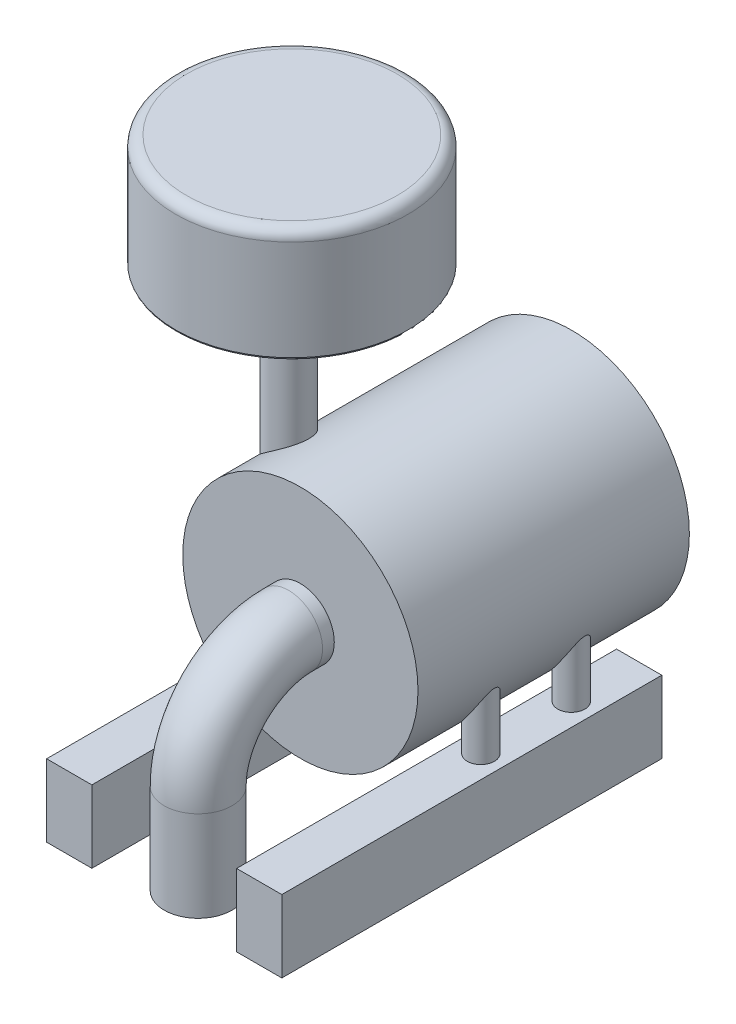
from build123d import *

# Parameters (mm, degrees)
SKETCH1_R                = 130
BOSS_EXTRUDE1_DEPTH      = 300
SKETCH2_R                = 37.5
BOSS_EXTRUDE2_DEPTH      = 13
SKETCH3_R                = 117
SKETCH3_R_2              = 72
CUT_EXTRUDE1_DEPTH       = 13
CUT_EXTRUDE1_DRAFT       = -30
SKETCH4_R                = 22.5
BOSS_EXTRUDE3_DEPTH      = 7
BOSS_EXTRUDE3_TAPER      = 30
BOSS_EXTRUDE4_REACH      = 665
BOSS_EXTRUDE4_END_RADIUS = 130
BOSS_EXTRUDE4_START      = 300
SKETCH5_R                = 22.5
SKETCH7_R                = 37.5
BOSS_EXTRUDE5_START      = -120
SKETCH9_W                = 50
SKETCH9_H                = 420
BOSS_EXTRUDE5_DEPTH      = 79.88
BOSS_EXTRUDE6_REACH      = 631.484
BOSS_EXTRUDE6_END_RADIUS = 130
SKETCH10_R               = 15
SHELL1_T                 = -2


with BuildPart() as part:
    # Sketch1 → Boss-Extrude1 (new body)
    with BuildSketch(Plane.XY):
        Circle(SKETCH1_R)
    extrude(amount=BOSS_EXTRUDE1_DEPTH)

    # Sketch2 → Boss-Extrude2 (add)
    with BuildSketch(Plane.XY.offset(300)):
        with Locations(Location((0, 0, 0), (0, 0, 180))):
            Circle(SKETCH2_R)
    extrude(amount=BOSS_EXTRUDE2_DEPTH)


with BuildPart() as cut_extrude1_tool:
    # Sketch3 → Cut-Extrude1 (with draft: the straight prism first)
    with BuildSketch(Plane(origin=(0, 0, 0), x_dir=(-1, 0, 0), z_dir=(0, 0, -1))):
        Circle(SKETCH3_R)
        Circle(SKETCH3_R_2, mode=Mode.SUBTRACT)
    extrude(amount=-CUT_EXTRUDE1_DEPTH)
    # Cut-Extrude1: the draft: its side faces are tilted about the plane it starts from
    cut_extrude1_sides = [cut_extrude1_tool.faces().sort_by_distance(p)[0] for p in [
        (117, 0, 6.5),
        (72, 0, 6.5),
    ]]
    draft(cut_extrude1_sides, Plane(origin=(0, 0, 0), x_dir=(-1, 0, 0), z_dir=(0, 0, -1)), CUT_EXTRUDE1_DRAFT)


with BuildPart() as part_1:
    add(part.part)

    # Cut-Extrude1: cut by cut_extrude1_tool
    add(cut_extrude1_tool.part, mode=Mode.SUBTRACT)

    # Sketch4 → Boss-Extrude3 (add)
    with BuildSketch(Plane(origin=(0, 0, 0), x_dir=(-1, 0, 0), z_dir=(0, 0, -1))):
        Circle(SKETCH4_R)
    extrude(amount=BOSS_EXTRUDE3_DEPTH, taper=BOSS_EXTRUDE3_TAPER)

    # Boss-Extrude4: up to this cylinder (the profile starts outside it)
    boss_extrude4_end = Plane(origin=(0, 0, 238), z_dir=(0, 0, -1)) * Cylinder(BOSS_EXTRUDE4_END_RADIUS, 1591, mode=Mode.PRIVATE)
    # Sketch5 → Boss-Extrude4 (add, up to the surface)
    with BuildSketch(Plane(origin=(0, 0, 0), x_dir=(1, 0, 0), z_dir=(0, 1, 0)).offset(BOSS_EXTRUDE4_START), mode=Mode.PRIVATE) as boss_extrude4_sk1:
        with Locations(Location((-75, -238, 0), (0, 0, 270))):
            Circle(SKETCH5_R)
    boss_extrude4_tool1 = extrude(boss_extrude4_sk1.sketch, amount=-BOSS_EXTRUDE4_REACH, mode=Mode.PRIVATE) - boss_extrude4_end
    add(boss_extrude4_tool1.solids().sort_by_distance((-75, 300, 238))[0])

    # Sweep1: sweep along a path in Sketch8
    with BuildLine(Plane(origin=(0, 0, 0), x_dir=(0, 0, -1), z_dir=(1, 0, 0))) as sweep1_path:
        Line((-413, -200), (-413, -100))
        ThreePointArc((-413, -100), (-383.710678119, -29.289321881), (-313, 0))
    # Sketch7 → Sweep1 (sweep)
    with BuildSketch(Plane.XY.offset(313)):
        Circle(SKETCH7_R)
    sweep(path=sweep1_path.line)



with BuildPart() as body_2:
    # Sketch9 → Boss-Extrude5 (new body)
    with BuildSketch(Plane(origin=(0, 0, 0), x_dir=(1, 0, 0), z_dir=(0, 1, 0)).offset(BOSS_EXTRUDE5_START)):
        with Locations((-105, -240.5)):
            Rectangle(SKETCH9_W, SKETCH9_H)
    boss_extrude5 = extrude(amount=-BOSS_EXTRUDE5_DEPTH)


with BuildPart() as part_2:
    add(part_1.part)

    add(body_2.part)  # Boss-Extrude6 merges body 2
    # Boss-Extrude6: up to this cylinder (the profile starts outside it)
    boss_extrude6_end = Plane(origin=(0, 0, 155.5), z_dir=(0, 0, -1)) * Cylinder(BOSS_EXTRUDE6_END_RADIUS, 1623.968, mode=Mode.PRIVATE)
    # Sketch10 → Boss-Extrude6 (add, up to the surface)
    with BuildSketch(Plane(origin=(0, -120, 0), x_dir=(1, 0, 0), z_dir=(0, 1, 0)), mode=Mode.PRIVATE) as boss_extrude6_sk1:
        with Locations(Location((-105, -105.5, 0), (0, 0, 90))):
            Circle(SKETCH10_R)
    boss_extrude6_tool1 = extrude(boss_extrude6_sk1.sketch, amount=BOSS_EXTRUDE6_REACH, mode=Mode.PRIVATE) - boss_extrude6_end
    # Sketch10 → Boss-Extrude6 (add, up to the surface)
    with BuildSketch(Plane(origin=(0, -120, 0), x_dir=(1, 0, 0), z_dir=(0, 1, 0)), mode=Mode.PRIVATE) as boss_extrude6_sk2:
        with Locations(Location((-105, -205.5, 0), (0, 0, 90))):
            Circle(SKETCH10_R)
    boss_extrude6_tool2 = extrude(boss_extrude6_sk2.sketch, amount=BOSS_EXTRUDE6_REACH, mode=Mode.PRIVATE) - boss_extrude6_end
    boss_extrude6 = boss_extrude6_tool1.solids().sort_by_distance((-105, -120, 105.5))[0] + boss_extrude6_tool2.solids().sort_by_distance((-105, -120, 205.5))[0]
    add(boss_extrude6)

    # Mirror2: Boss-Extrude5, Boss-Extrude6 across plane
    add(boss_extrude5.mirror(Plane(origin=(0, 0, 0), x_dir=(0, 0, 1), z_dir=(1, 0, 0))))
    add(boss_extrude6.mirror(Plane(origin=(0, 0, 0), x_dir=(0, 0, 1), z_dir=(1, 0, 0))))

    # Sketch12 → Revolve1 (revolve)
    with BuildSketch(Plane.ZY.offset(71.410035236), mode=Mode.PRIVATE) as revolve1_sk:
        with BuildLine():
            Line((238, 300), (310.438101547, 300))
            ThreePointArc((310.438101547, 300), (310.820040176, 299.99902748), (311.2019689, 299.996109944))
            ThreePointArc((311.2019689, 299.996109944), (339.560496789, 293.677441535), (362.910830946, 276.388902868))
            ThreePointArc((362.910830946, 276.388902868), (365.1172816, 275.844076005), (366.4085968, 277.714307502))
            Line((366.4085968, 277.714307502), (366.4085968, 388.3836732))
            ThreePointArc((366.4085968, 388.3836732), (362.893878175, 396.868954574), (354.4085968, 400.3836732))
            Line((354.4085968, 400.3836732), (238, 400.3836732))
            Line((238, 400.3836732), (238, 300))
        make_face()
    revolve(revolve1_sk.sketch.rotate(Axis((-71.410035236, 300, 238), (0, 1, 0)), 180), axis=Axis((-71.410035236, 300, 238), (0, 1, 0)))

    # Shell1
    shell1_openings = [part_2.faces().sort_by_distance(p)[0] for p in [
        (0, -200, 413),
    ]]
    offset(amount=SHELL1_T, openings=shell1_openings, kind=Kind.INTERSECTION)


solid = part_2.part
